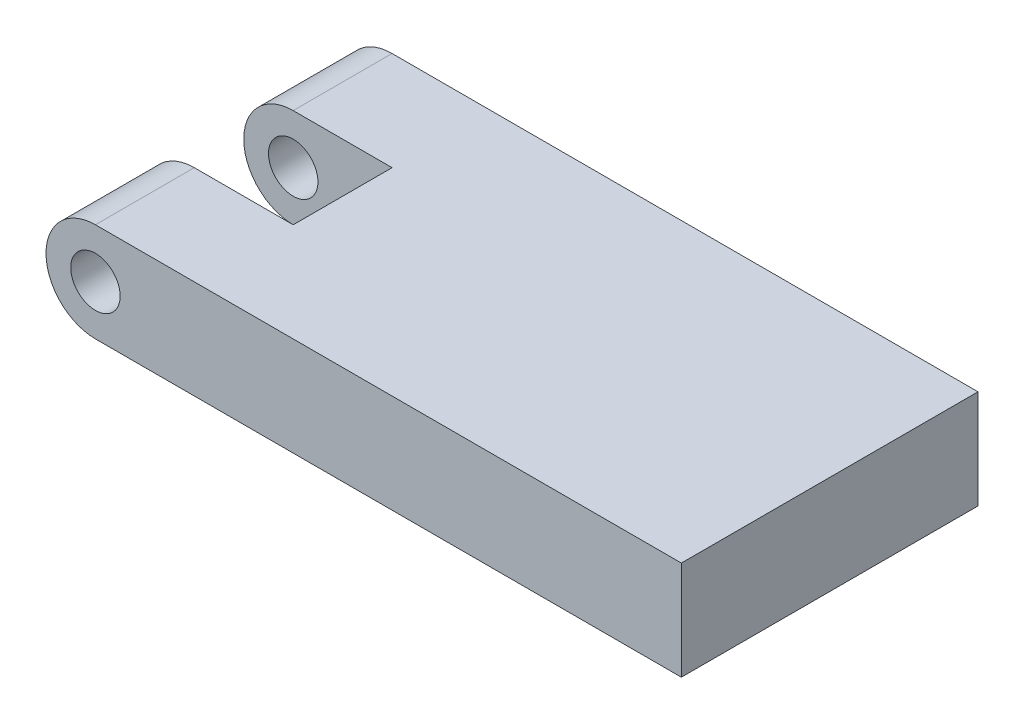
from build123d import *

# Parameters (mm, degrees)
BOSS_EXTRUDE1_DEPTH     = 60
CUT_EXTRUDE1_DEPTH      = 20
CUT_EXTRUDE1_DEPTH_BACK = 40
SKETCH2_W               = 20
SKETCH2_H               = 28.944782362
SKETCH3_R               = 5
CUT_EXTRUDE3_DEPTH      = 120
SKETCH4_W               = 60
SKETCH4_H               = 20
BOSS_EXTRUDE2_DEPTH     = 65


with BuildPart() as part:
    # Sketch1 → Boss-Extrude1 (new body)
    with BuildSketch(Plane.XY):
        with BuildLine():
            Line((53.512258846, 10), (0, 10))
            ThreePointArc((0, 10), (-10, 0), (0, -10))
            Line((0, -10), (53.512258846, -10))
            Line((53.512258846, -10), (53.512258846, 10))
        make_face()
    extrude(amount=BOSS_EXTRUDE1_DEPTH)

    # Sketch2 → Cut-Extrude1 (cut, two sides: drawn at the far end of the back side and taken through both)
    with BuildSketch(Plane(origin=(0, 0, 0), x_dir=(0, 0, -1), z_dir=(1, 0, 0)).offset(-CUT_EXTRUDE1_DEPTH_BACK)):
        with Locations((-30, 0)):
            Rectangle(SKETCH2_W, SKETCH2_H)
    extrude(amount=CUT_EXTRUDE1_DEPTH + CUT_EXTRUDE1_DEPTH_BACK, mode=Mode.SUBTRACT)

    # Sketch3 → Cut-Extrude3 (cut)
    with BuildSketch(Plane.XY.offset(60)):
        Circle(SKETCH3_R)
    extrude(amount=-CUT_EXTRUDE3_DEPTH, mode=Mode.SUBTRACT)

    # Sketch4 → Boss-Extrude2 (add)
    with BuildSketch(Plane(origin=(53.512258846, 0, 0), x_dir=(0, 0, -1), z_dir=(1, 0, 0))):
        with Locations((-30, 0)):
            Rectangle(SKETCH4_W, SKETCH4_H)
    extrude(amount=BOSS_EXTRUDE2_DEPTH)


solid = part.part
